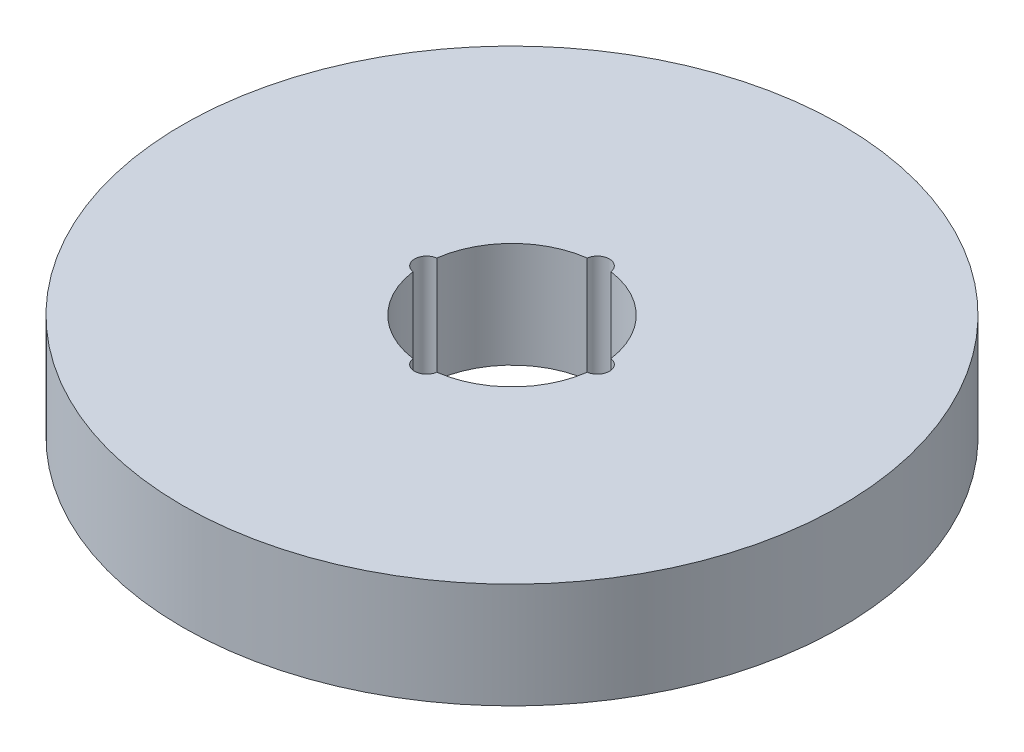
from build123d import *

# Parameters (mm, degrees)
SKETCH1_R           = 75
BOSS_EXTRUDE1_DEPTH = 24
SKETCH2_R           = 20
CUT_EXTRUDE1_DEPTH  = 109.747413762
SKETCH3_R           = 2.722199405
CUT_EXTRUDE2_DEPTH  = 23.626311199
CIRPATTERN1_COUNT   = 4


with BuildPart() as part:
    # Sketch1 → Boss-Extrude1 (new body)
    with BuildSketch(Plane(origin=(0, 0, 0), x_dir=(1, 0, 0), z_dir=(0, 1, 0))):
        Circle(SKETCH1_R)
    extrude(amount=BOSS_EXTRUDE1_DEPTH)

    # Sketch2 → Cut-Extrude1 (cut, through all)
    with BuildSketch(Plane(origin=(0, 0, 0), x_dir=(1, 0, 0), z_dir=(0, 1, 0))):
        Circle(SKETCH2_R)
    extrude(amount=CUT_EXTRUDE1_DEPTH, mode=Mode.SUBTRACT)

    # Sketch3 → Cut-Extrude2 (cut)
    with BuildSketch(Plane(origin=(0, 24, 0), x_dir=(1, 0, 0), z_dir=(0, 1, 0))):
        with Locations((-19.440736976, 0)):
            Circle(SKETCH3_R)
    cut_extrude2 = extrude(amount=-CUT_EXTRUDE2_DEPTH, mode=Mode.SUBTRACT)

    # CirPattern1: Cut-Extrude2 ×4 about axis
    cirpattern1_axis = Axis((0, 0, 0), (0, 1, 0))
    for i in range(1, CIRPATTERN1_COUNT):
        add(cut_extrude2.rotate(cirpattern1_axis, i * 360 / CIRPATTERN1_COUNT), mode=Mode.SUBTRACT)


solid = part.part
